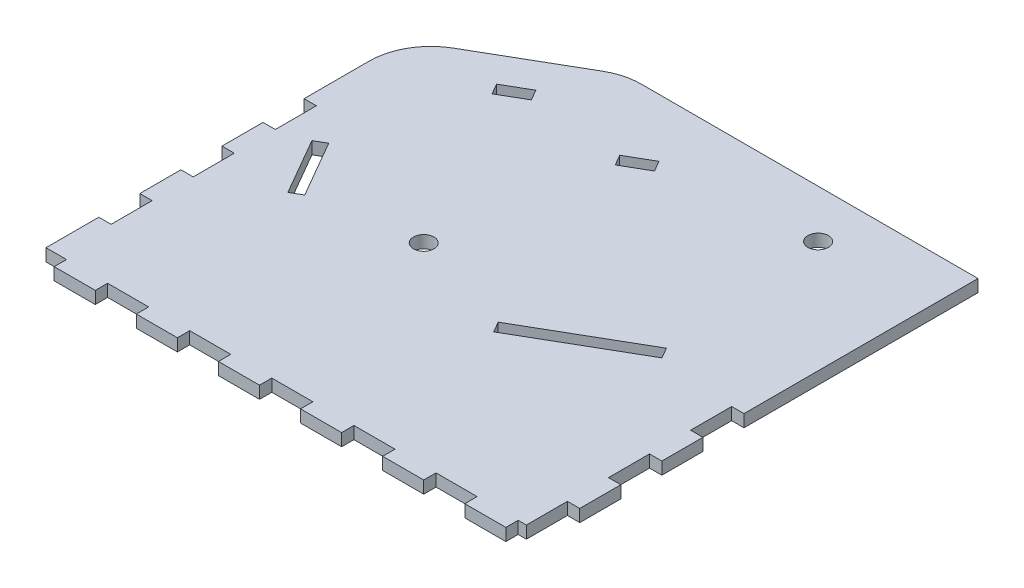
from build123d import *

# Parameters (mm, degrees)
CROQUIS1_R              = 2.5
SALIENTE_EXTRUIR1_DEPTH = 3


with BuildPart() as part:
    # Croquis1 → Saliente-Extruir1 (new body)
    with BuildSketch(Plane(origin=(0, 0, 0), x_dir=(1, 0, 0), z_dir=(0, 1, 0))):
        with BuildLine():
            Line((5, 3), (5, 0))
            Line((5, 0), (15, 0))
            Line((15, 0), (15, 3))
            Line((15, 3), (25, 3))
            Line((25, 3), (25, 0))
            Line((25, 0), (35, 0))
            Line((35, 0), (35, 3))
            Line((35, 3), (45, 3))
            Line((45, 3), (45, 0))
            Line((45, 0), (55, 0))
            Line((55, 0), (55, 3))
            Line((55, 3), (60, 3))
            Line((60, 3), (65, 3))
            Line((65, 3), (65, 0))
            Line((65, 0), (75, 0))
            Line((75, 0), (75, 3))
            Line((75, 3), (85, 3))
            Line((85, 3), (85, 0))
            Line((85, 0), (92.72, 0))
            Line((92.72, 0), (95, 0))
            Line((95, 0), (95, 3))
            Line((95, 3), (105, 3))
            Line((105, 3), (105, 0))
            Line((105, 0), (115, 0))
            Line((115, 0), (115, 3))
            Line((115, 3), (117, 3))
            Line((117, 3), (117, 13))
            Line((117, 13), (120, 13))
            Line((120, 13), (120, 23))
            Line((120, 23), (117, 23))
            Line((117, 23), (117, 33))
            Line((117, 33), (120, 33))
            Line((120, 33), (120, 43))
            Line((120, 43), (117, 43))
            Line((117, 43), (117, 53))
            Line((117, 53), (120, 53))
            Line((120, 53), (120, 110))
            Line((120, 110), (38.022727339, 110))
            ThreePointArc((38.022727339, 110), (34.140441662, 109.488887394), (30.522727339, 107.990381057))
            Line((30.522727339, 107.990381057), (7.5, 94.69820323))
            ThreePointArc((7.5, 94.69820323), (2.009618943, 89.207822174), (0, 81.707822174))
            Line((0, 81.707822174), (0, 65.853911087))
            Line((0, 65.853911087), (3, 65.853911087))
            Line((3, 65.853911087), (3, 55.853911087))
            Line((3, 55.853911087), (0, 55.853911087))
            Line((0, 55.853911087), (0, 45.853911087))
            Line((0, 45.853911087), (3, 45.853911087))
            Line((3, 45.853911087), (3, 40.853911087))
            Line((3, 40.853911087), (3, 35.853911087))
            Line((3, 35.853911087), (0, 35.853911087))
            Line((0, 35.853911087), (0, 25.853911087))
            Line((0, 25.853911087), (3, 25.853911087))
            Line((3, 25.853911087), (3, 15.853911087))
            Line((3, 15.853911087), (0, 15.853911087))
            Line((0, 15.853911087), (0, 3))
            Line((0, 3), (5, 3))
        make_face()
        Polygon((12.398076211, 59.469872981), (16.398076211, 52.541669751), (20.398076211, 45.613466521), (17.8, 44.113466521), (9.8, 57.969872981), align=None, mode=Mode.SUBTRACT)
        with Locations((45, 50)):
            Circle(CROQUIS1_R, mode=Mode.SUBTRACT)
        Polygon((70.776406461, 42.36), (83.766787517, 49.86), (96.757168574, 57.36), (98.257168574, 54.761923789), (85.266787517, 47.261923789), (72.276406461, 39.761923789), align=None, mode=Mode.SUBTRACT)
        Polygon((20.374101615, 92.368076211), (23.405190528, 94.118076211), (26.436279442, 95.868076211), (27.936279442, 93.27), (24.905190528, 91.52), (21.874101615, 89.77), align=None, mode=Mode.SUBTRACT)
        Polygon((53.405190528, 94.118076211), (56.436279442, 95.868076211), (57.936279442, 93.27), (54.905190528, 91.52), (51.874101615, 89.77), (50.374101615, 92.368076211), align=None, mode=Mode.SUBTRACT)
        with Locations((92.72, 98.34)):
            Circle(CROQUIS1_R, mode=Mode.SUBTRACT)
    extrude(amount=SALIENTE_EXTRUIR1_DEPTH)


solid = part.part
